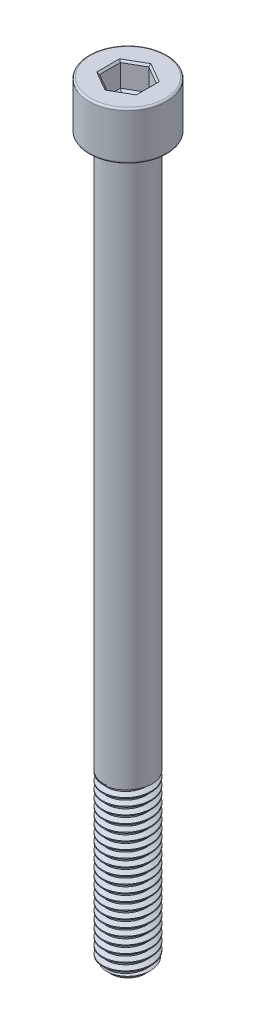
from build123d import *

# Parameters (mm, degrees)
SKETCH1_R           = 4
BOSS_EXTRUDE1_DEPTH = 28
THREAD1_PITCH       = 1.25
SKETCH2_R           = 4
BOSS_EXTRUDE2_DEPTH = 92
SKETCH5_R           = 6.5
BOSS_EXTRUDE3_DEPTH = 8
FILLET1_R           = 0.3
CUT_EXTRUDE1_DEPTH  = 4
CHAMFER1_SIZE       = 0.3
CUT_EXTRUDE2_DEPTH  = 0.4
CUT_EXTRUDE2_DRAFT  = -60


with BuildPart() as part:
    # Sketch1 → Boss-Extrude1 (new body)
    with BuildSketch(Plane(origin=(0, 0, 0), x_dir=(1, 0, 0), z_dir=(0, 1, 0))):
        with Locations(Location((0, 0, 0), (0, 0, 270))):
            Circle(SKETCH1_R)
    extrude(amount=BOSS_EXTRUDE1_DEPTH)

    # Thread1: the profile of Thread Profile1 profile screwed along a right-hand helix of 24 turns, 8 arcs to a turn; built about Z, then put on its axis
    thread1_z = Axis((0, 0, 0), (0, 0, 1))
    thread1_corners = [(4.0003, 0, -0.000173205), (4.0003, 0, 1.093923202), (3.323417656, 0, 0.703124998), (3.323417656, 0, 0.390624998)]
    with BuildLine(mode=Mode.PRIVATE) as thread1_profile:
        Line(thread1_corners[0], thread1_corners[1])
        Line(thread1_corners[1], thread1_corners[2])
        Line(thread1_corners[2], thread1_corners[3])
        Line(thread1_corners[3], thread1_corners[0])
    thread1_cap = Face(thread1_profile.wire())
    thread1_turn_angles = [0, 22.5, 45, 67.5, 90, 112.5, 135, 157.5, 180, 202.5, 225, 247.5, 270, 292.5, 315, 337.5, 360]
    thread1_turn_weights = [1, 0.9238795325112867, 1, 0.9238795325112867, 1, 0.9238795325112867, 1, 0.9238795325112867, 1, 0.9238795325112867, 1, 0.9238795325112867, 1, 0.9238795325112867, 1, 0.9238795325112867, 1]
    thread1_turn_rails = [Edge.make_bspline([Vector(p[0], p[1], 0).rotate(thread1_z, thread1_turn_angles[k]) / thread1_turn_weights[k] + Vector(0, 0, p[2] + THREAD1_PITCH * thread1_turn_angles[k] / 360) for k in range(17)], [0, 0, 0, 1, 1, 2, 2, 3, 3, 4, 4, 5, 5, 6, 6, 7, 7, 8, 8, 8], 2, thread1_turn_weights) for p in thread1_corners]
    thread1_turn_sides = [Face.make_surface_from_curves(thread1_turn_rails[p[0]], thread1_turn_rails[p[1]]) for p in [(0, 1), (1, 2), (2, 3), (3, 0)]]
    thread1 = Plane(origin=(0, 30, 0), x_dir=(-1, 0, 0), z_dir=(0, -1, 0)) * Solid(Shell([*[p.moved(Location((0, 0, THREAD1_PITCH * i))) for i in range(24) for p in thread1_turn_sides], thread1_cap, thread1_cap.rotate(thread1_z, 8640).moved(Location((0, 0, THREAD1_PITCH * 8640 / 360)))]))
    add(thread1, mode=Mode.SUBTRACT)

    # Sketch2 → Boss-Extrude2 (add)
    with BuildSketch(Plane(origin=(0, 28, 0), x_dir=(1, 0, 0), z_dir=(0, 1, 0))):
        with Locations(Location((0, 0, 0), (0, 0, 117.593571361))):
            Circle(SKETCH2_R)
    extrude(amount=BOSS_EXTRUDE2_DEPTH)

    # Sketch5 → Boss-Extrude3 (add)
    with BuildSketch(Plane(origin=(0, 120, 0), x_dir=(1, 0, 0), z_dir=(0, 1, 0))):
        with Locations(Location((0, 0, 0), (0, 0, 270))):
            Circle(SKETCH5_R)
    extrude(amount=BOSS_EXTRUDE3_DEPTH)

    # Sketch6 → Cut-Revolve1 (revolve, cut)
    with BuildSketch(Plane.XY, mode=Mode.PRIVATE) as cut_revolve1_sk:
        Polygon((4.01, 0), (4.01, 1.2), (2.81, 0), align=None)
    revolve(cut_revolve1_sk.sketch.rotate(Axis((0, 0, 0), (0, 1, 0)), 117.593571361), axis=Axis((0, 0, 0), (0, 1, 0)), mode=Mode.SUBTRACT)

    # Fillet1
    fillet1_edges = [part.edges().sort_by_distance(p)[0] for p in [
        (0, 120, -6.5),
        (0, 128, -6.5),
    ]]
    fillet(fillet1_edges, radius=FILLET1_R)

    # Sketch7 → Cut-Extrude1 (cut)
    with BuildSketch(Plane(origin=(0, 128, 0), x_dir=(1, 0, 0), z_dir=(0, 1, 0))):
        Polygon((0, 3.464101615), (-3, 1.732050808), (-3, -1.732050808), (0, -3.464101615), (3, -1.732050808), (3, 1.732050808), align=None)
    extrude(amount=-CUT_EXTRUDE1_DEPTH, mode=Mode.SUBTRACT)

    # Chamfer1
    chamfer1_edges = [part.edges().sort_by_distance(p)[0] for p in [
        (1.5, 128, -2.598076211),
        (-1.5, 128, -2.598076211),
        (-3, 128, 0),
        (-1.5, 128, 2.598076211),
        (1.5, 128, 2.598076211),
        (3, 128, 0),
    ]]
    chamfer(chamfer1_edges, length=CHAMFER1_SIZE)


with BuildPart() as cut_extrude2_tool:
    # Sketch8 → Cut-Extrude2 (with draft: the straight prism first)
    with BuildSketch(Plane(origin=(0, 124, 0), x_dir=(1, 0, 0), z_dir=(0, 1, 0))):
        Polygon((0, 3.464101615), (-3, 1.732050808), (-3, -1.732050808), (0, -3.464101615), (3, -1.732050808), (3, 1.732050808), align=None)
    extrude(amount=-CUT_EXTRUDE2_DEPTH)
    # Cut-Extrude2: the draft: its side faces are tilted about the plane it starts from
    cut_extrude2_sides = [cut_extrude2_tool.faces().sort_by_distance(p)[0] for p in [
        (-1.5, 123.8, -2.598076211),
        (-3, 123.8, 0),
        (-1.5, 123.8, 2.598076211),
        (1.5, 123.8, 2.598076211),
        (3, 123.8, 0),
        (1.5, 123.8, -2.598076211),
    ]]
    draft(cut_extrude2_sides, Plane(origin=(0, 124, 0), x_dir=(1, 0, 0), z_dir=(0, 1, 0)), CUT_EXTRUDE2_DRAFT)


with BuildPart() as part_1:
    add(part.part)

    # Cut-Extrude2: cut by cut_extrude2_tool
    add(cut_extrude2_tool.part, mode=Mode.SUBTRACT)


solid = part_1.part
